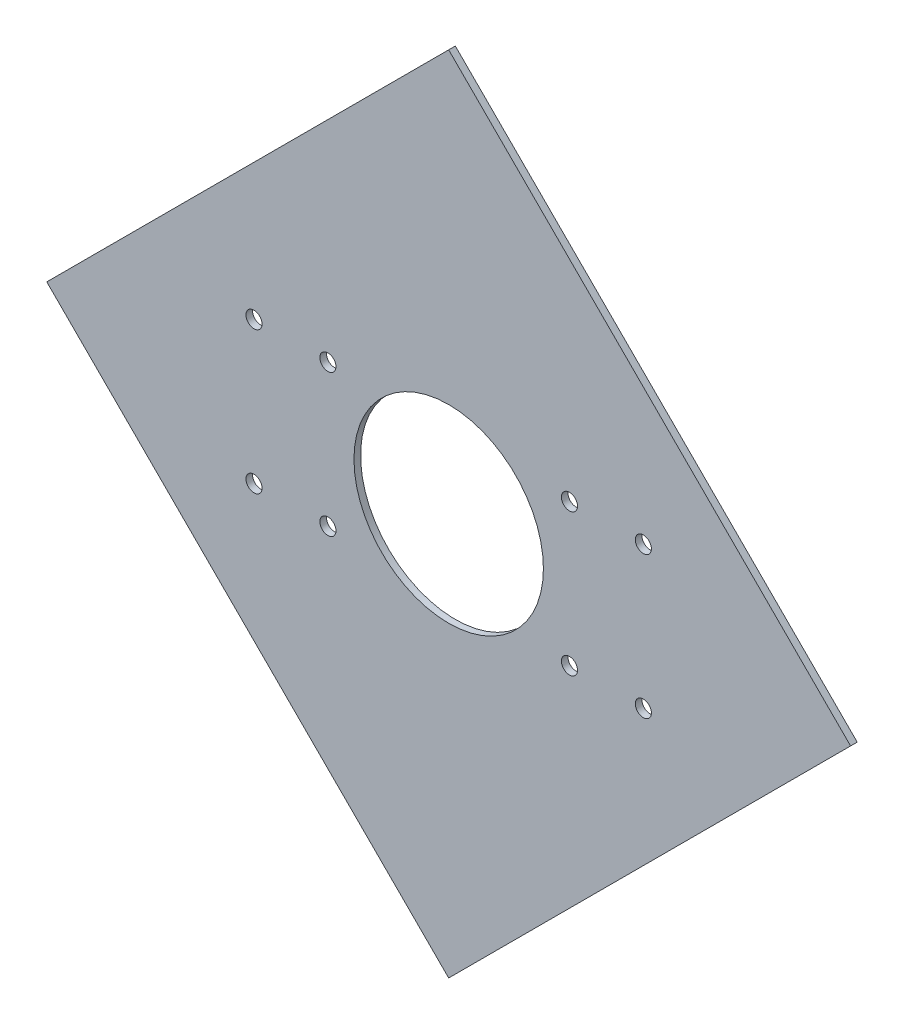
from build123d import *

# Parameters (mm, degrees)
BASE_FLANGE1_DEPTH      = 1.4
CUT_EXTRUDE1_DEPTH      = 190.741824593
CUT_EXTRUDE1_DEPTH_BACK = 190.741824593
MOTOR_HOLE_R            = 20
CUT_EXTRUDE2_DEPTH      = 190.741824593
CUT_EXTRUDE2_DEPTH_BACK = 190.741824593
SKETCH9_R               = 1.7


# Sheet-metal steps are written as plain solids
with BuildPart() as part:
    # Sketch1 → Base-Flange1 (new body)
    with BuildSketch(Plane.XY):
        Polygon((0, 0), (84.852813742, 84.852813742), (0, 169.705627485), (-84.852813742, 84.852813742), align=None)
    extrude(amount=-BASE_FLANGE1_DEPTH)

    # Motor hole → Cut-Extrude1 (cut, two sides: drawn at the far end of the back side and taken through both)
    with BuildSketch(Plane.XY.offset(-CUT_EXTRUDE1_DEPTH_BACK)):
        with Locations((0, 84.852813742)):
            Circle(MOTOR_HOLE_R)
    extrude(amount=CUT_EXTRUDE1_DEPTH + CUT_EXTRUDE1_DEPTH_BACK, mode=Mode.SUBTRACT)

    # Sketch9 → Cut-Extrude2 (cut, two sides: drawn at the far end of the back side and taken through both)
    with BuildSketch(Plane.XY.offset(-CUT_EXTRUDE2_DEPTH_BACK)):
        with Locations((-41.1, 99.852813742)):
            Circle(SKETCH9_R)
        with Locations((-25.5, 99.852813742)):
            Circle(SKETCH9_R)
        with Locations((-41.1, 69.852813742)):
            Circle(SKETCH9_R)
        with Locations((-25.5, 69.852813742)):
            Circle(SKETCH9_R)
        with Locations((25.5, 99.852813742)):
            Circle(SKETCH9_R)
        with Locations((41.1, 99.852813742)):
            Circle(SKETCH9_R)
        with Locations((25.5, 69.852813742)):
            Circle(SKETCH9_R)
        with Locations((41.1, 69.852813742)):
            Circle(SKETCH9_R)
    extrude(amount=CUT_EXTRUDE2_DEPTH + CUT_EXTRUDE2_DEPTH_BACK, mode=Mode.SUBTRACT)


solid = part.part
